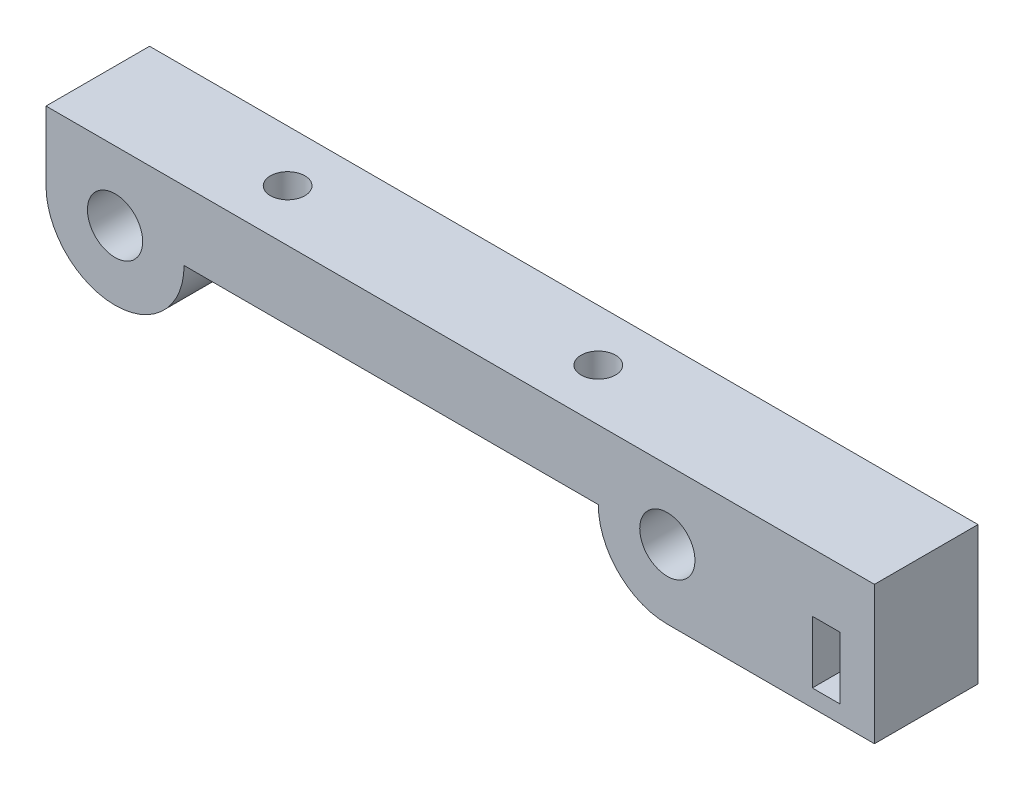
from build123d import *

# Parameters (mm, degrees)
ESBO_O1_R                = 4
ESBO_O1_W                = 4
ESBO_O1_H                = 9
RESSALTO_EXTRUS_O1_DEPTH = 15
ESBO_O2_R                = 2.5
CORTE_EXTRUS_O1_DEPTH    = 15


with BuildPart() as part:
    # Esboço1 → Ressalto-extrusão1 (new body)
    with BuildSketch(Plane.XY):
        with BuildLine():
            Line((50, 0), (70, 0))
            Line((70, 0), (70, -20))
            Line((70, -20), (40, -20))
            ThreePointArc((40, -20), (32.928932188, -17.071067812), (30, -10))
            Line((30, -10), (-30, -10))
            ThreePointArc((-30, -10), (-40, -20), (-50, -10))
            Line((-50, -10), (-50, 0))
            Line((-50, 0), (50, 0))
        make_face()
        with Locations((-40, -10)):
            Circle(ESBO_O1_R, mode=Mode.SUBTRACT)
        with Locations((40, -10)):
            Circle(ESBO_O1_R, mode=Mode.SUBTRACT)
        with Locations((63, -13)):
            Rectangle(ESBO_O1_W, ESBO_O1_H, mode=Mode.SUBTRACT)
    extrude(amount=RESSALTO_EXTRUS_O1_DEPTH)

    # Esboço2 → Corte-extrusão1 (cut)
    with BuildSketch(Plane.XZ.offset(10)):
        with Locations((-22.5, 7.5)):
            Circle(ESBO_O2_R)
        with Locations((22.5, 7.5)):
            Circle(ESBO_O2_R)
    extrude(amount=-CORTE_EXTRUS_O1_DEPTH, mode=Mode.SUBTRACT)


solid = part.part
